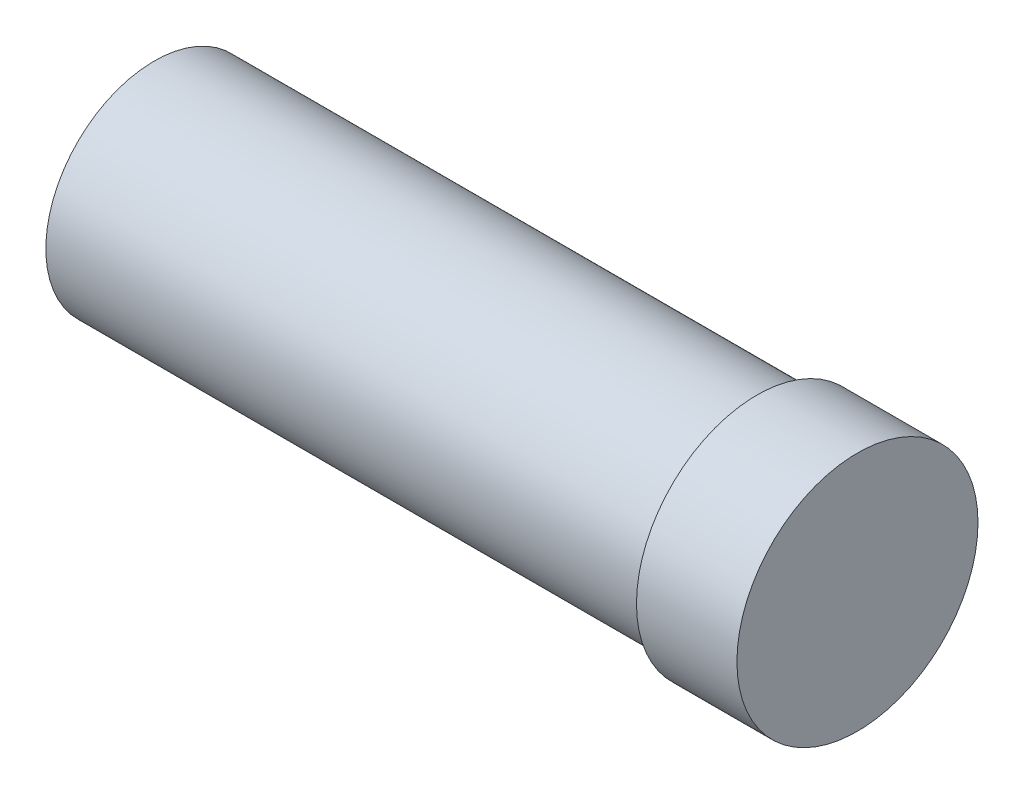
from build123d import *

# Parameters (mm, degrees)
SKETCH2_R           = 27
BOSS_EXTRUDE1_DEPTH = 150
SKETCH3_R           = 30
BOSS_EXTRUDE2_DEPTH = 25


with BuildPart() as part:
    # Sketch2 → Boss-Extrude1 (new body)
    with BuildSketch(Plane(origin=(0, 0, 0), x_dir=(0, 0, -1), z_dir=(1, 0, 0))):
        Circle(SKETCH2_R)
    extrude(amount=BOSS_EXTRUDE1_DEPTH)

    # Sketch3 → Boss-Extrude2 (add)
    with BuildSketch(Plane(origin=(150, 0, 0), x_dir=(0, 0, -1), z_dir=(1, 0, 0))):
        Circle(SKETCH3_R)
    extrude(amount=BOSS_EXTRUDE2_DEPTH)


solid = part.part
